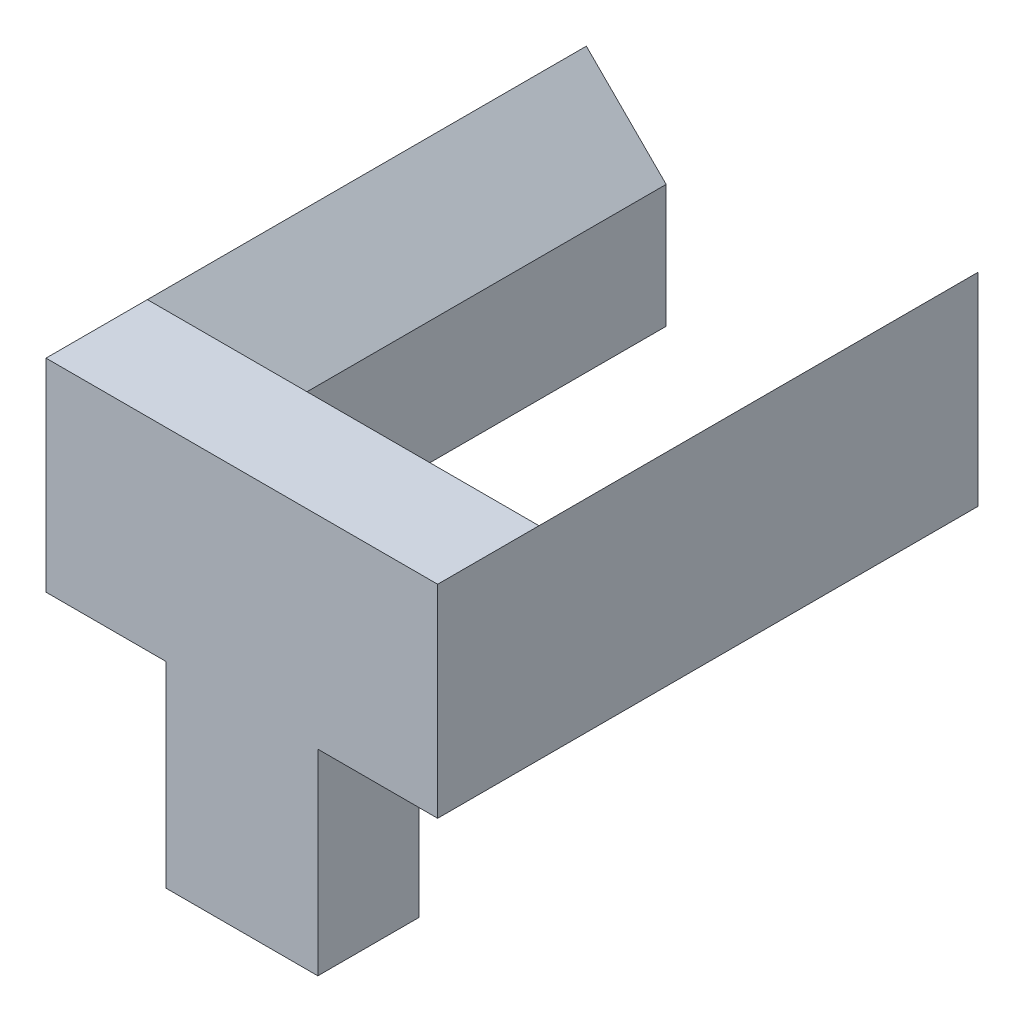
from build123d import *

# Parameters (mm, degrees)
SKETCH1_W           = 38.1
SKETCH1_H           = 25.4
BOSS_EXTRUDE1_DEPTH = 99.9998
SKETCH2_W           = 25.4
SKETCH2_H           = 50.8
BOSS_EXTRUDE2_DEPTH = 30.0228
SKETCH3_W           = 25.4
SKETCH3_H           = 50.8
BOSS_EXTRUDE3_DEPTH = 30.0228
BOSS_EXTRUDE4_DEPTH = 110.0074
BOSS_EXTRUDE5_DEPTH = 110.0074
SKETCH8_R           = 3.81
CUT_EXTRUDE1_DEPTH  = 25.4


with BuildPart() as part:
    # Sketch1 → Boss-Extrude1 (new body)
    with BuildSketch(Plane(origin=(0, 0, 0), x_dir=(1, 0, 0), z_dir=(0, 1, 0))):
        with Locations((5.061883246, 0.142486096)):
            Rectangle(SKETCH1_W, SKETCH1_H)
    extrude(amount=BOSS_EXTRUDE1_DEPTH)

    # Sketch2 → Boss-Extrude2 (add)
    with BuildSketch(Plane(origin=(24.111883246, 0, 0), x_dir=(0, 0, -1), z_dir=(1, 0, 0))):
        with Locations((0.142486096, 74.5998)):
            Rectangle(SKETCH2_W, SKETCH2_H)
    extrude(amount=BOSS_EXTRUDE2_DEPTH)

    # Sketch3 → Boss-Extrude3 (add)
    with BuildSketch(Plane.ZY.offset(13.988116754)):
        with Locations((-0.142486096, 74.5998)):
            Rectangle(SKETCH3_W, SKETCH3_H)
    extrude(amount=BOSS_EXTRUDE3_DEPTH)

    # Sketch4 → Boss-Extrude4 (add)
    with BuildSketch(Plane(origin=(0, 0, -12.842486096), x_dir=(-1, 0, 0), z_dir=(0, 0, -1))):
        Polygon((-54.134683246, 99.9998), (-54.134683246, 49.1998), (-36.166683176, 49.1998), (-36.166683176, 79.99979993), align=None)
    extrude(amount=BOSS_EXTRUDE4_DEPTH)

    # Sketch5 → Boss-Extrude5 (add)
    with BuildSketch(Plane(origin=(0, 0, -12.842486096), x_dir=(-1, 0, 0), z_dir=(0, 0, -1))):
        Polygon((44.010916754, 99.9998), (44.010916754, 49.1998), (24.010916684, 49.1998), (24.010916684, 79.99979993), align=None)
    extrude(amount=BOSS_EXTRUDE5_DEPTH)

    # Sketch8 → Cut-Extrude1 (cut)
    with BuildSketch(Plane.XZ):
        with Locations((-4.938116754, -0.142486096)):
            Circle(SKETCH8_R)
        with Locations((15.061883246, -0.142486096)):
            Circle(SKETCH8_R)
    extrude(amount=-CUT_EXTRUDE1_DEPTH, mode=Mode.SUBTRACT)


solid = part.part
